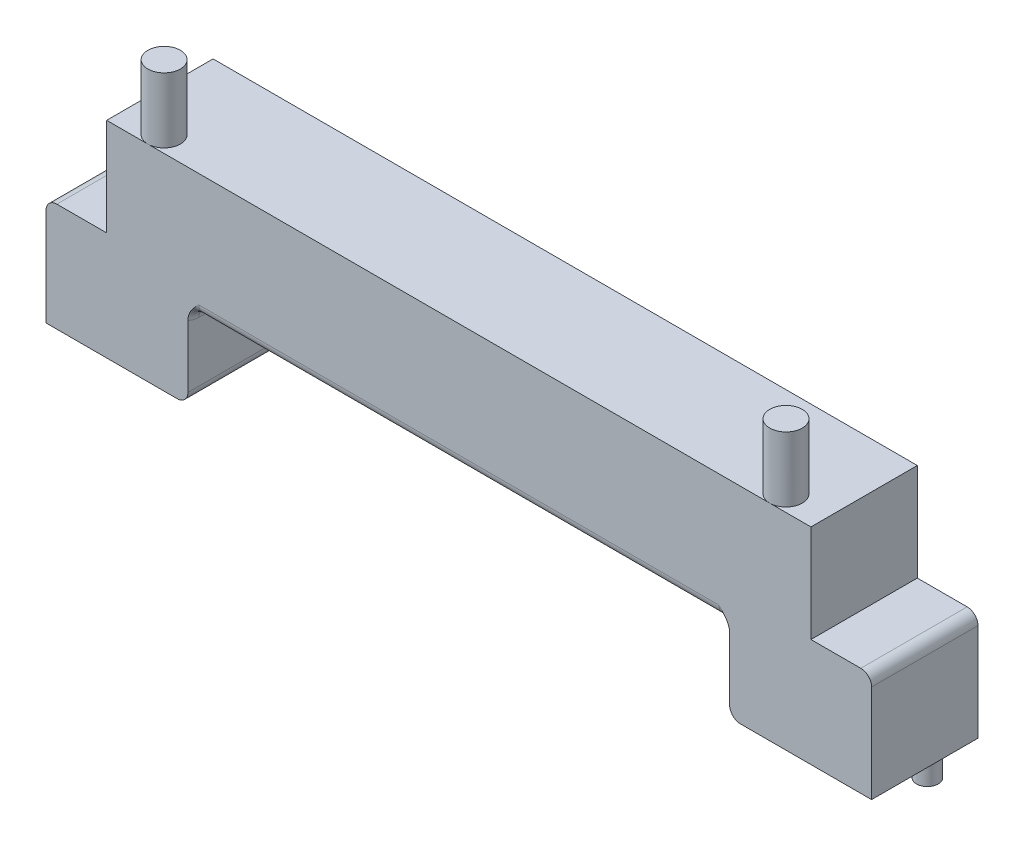
from build123d import *

# Parameters (mm, degrees)
BOSS_EXTRUDE1_DEPTH = 9.82
SKETCH3_R           = 1.5
BOSS_EXTRUDE2_DEPTH = 6
SKETCH5_R           = 1
BOSS_EXTRUDE3_DEPTH = 4
FILLET1_R           = 1
FILLET3_R           = 1


with BuildPart() as part:
    # Sketch2 → Boss-Extrude1 (new body)
    with BuildSketch(Plane.XY):
        Polygon((0, 10), (5.6, 10), (5.6, 19), (70.6, 19), (70.6, 10), (76.2, 10), (76.2, 0), (63.1, 0), (63.1, 7.5), (13.1, 7.5), (13.1, 0), (0, 0), align=None)
    extrude(amount=-BOSS_EXTRUDE1_DEPTH)

    # Sketch3 → Boss-Extrude2 (add)
    with BuildSketch(Plane(origin=(0, 19, 0), x_dir=(1, 0, 0), z_dir=(0, 1, 0))):
        with Locations(Location((9.4, 1.5, 0), (0, 0, 270))):
            Circle(SKETCH3_R)
        with Locations(Location((66.8, 1.5, 0), (0, 0, 90))):
            Circle(SKETCH3_R)
    extrude(amount=BOSS_EXTRUDE2_DEPTH)

    # Sketch5 → Boss-Extrude3 (add)
    with BuildSketch(Plane.XZ):
        with Locations(Location((73.025, -8.32, 0), (0, 0, 270))):
            Circle(SKETCH5_R)
        with Locations(Location((3.175, -8.32, 0), (0, 0, 90))):
            Circle(SKETCH5_R)
    extrude(amount=BOSS_EXTRUDE3_DEPTH)

    # Fillet1
    fillet1_edges = [part.edges().sort_by_distance(p)[0] for p in [
        (38.1, 7.5, 0),
    ]]
    fillet(fillet1_edges, radius=FILLET1_R)

    # Fillet3
    # the kernel refuses this fillet: 1 mm, written as the material it adds along each edge
    with BuildSketch(Plane(origin=(63.1, 7.5, -1), x_dir=(-1, 0, 0), z_dir=(0, 0, -1))) as fillet3_piece_1:
        with BuildLine():
            CenterArc((FILLET3_R, -FILLET3_R), FILLET3_R, 90, 90)
            Line((0, -FILLET3_R), (0, 0))
            Line((0, 0), (FILLET3_R, 0))
        make_face()
    extrude(amount=8.82)
    with BuildSketch(Plane(origin=(13.1, 7.5, -1), x_dir=(1, 0, 0), z_dir=(0, 0, -1))) as fillet3_piece_2:
        with BuildLine():
            CenterArc((FILLET3_R, FILLET3_R), FILLET3_R, 180, 90)
            Line((0, FILLET3_R), (0, 0))
            Line((0, 0), (FILLET3_R, 0))
        make_face()
    extrude(amount=8.82)
    with BuildSketch(Plane(origin=(63.1, 8.5, -1), x_dir=(0, 0.5976672776328268, -0.8017442392976488), z_dir=(0, -0.8017442392976488, -0.5976672776328268))) as fillet3_piece_3_section:
        with BuildLine():
            CenterArc((1 + FILLET3_R, -FILLET3_R), FILLET3_R, 90, 90)
            Line((1 + FILLET3_R, 0), (1, 0))
            Line((1, 0), (1, -FILLET3_R))
        make_face()
    fillet3_piece_3 = revolve(axis=Axis((63.1, 8.5, -1), (1, 0, 0)), revolution_arc=233.296989237, mode=Mode.PRIVATE)
    fillet3_piece_3 = split(fillet3_piece_3, bisect_by=Plane(origin=(62.788371694, 7.750061053, 0), z_dir=(0, 0, -1)), keep=Keep.TOP, mode=Mode.PRIVATE)
    add(fillet3_piece_3)
    with BuildSketch(Plane(origin=(13.1, 8.5, -1), x_dir=(0, 0.5976672776328246, -0.8017442392976504), z_dir=(0, -0.8017442392976504, -0.5976672776328246))) as fillet3_piece_4_section:
        with BuildLine():
            CenterArc((1 + FILLET3_R, FILLET3_R), FILLET3_R, 180, 90)
            Line((1, FILLET3_R), (1, 0))
            Line((1, 0), (1 + FILLET3_R, 0))
        make_face()
    fillet3_piece_4 = revolve(axis=Axis((13.1, 8.5, -1), (1, 0, 0)), revolution_arc=233.296989237, mode=Mode.PRIVATE)
    fillet3_piece_4 = split(fillet3_piece_4, bisect_by=Plane(origin=(13.411628296, 7.750061029, 0), z_dir=(0, 0, -1)), keep=Keep.TOP, mode=Mode.PRIVATE)
    add(fillet3_piece_4)
    # the kernel refuses this fillet: 1 mm, written as the material it takes off along each edge
    with BuildSketch(Plane(origin=(63.1, 0, 2.5), x_dir=(0, 1, 0), z_dir=(0, 0, -1)), Plane(origin=(13.1, 0, 2.5), x_dir=(-1, 0, 0), z_dir=(0, 0, -1)), Plane(origin=(0, 10, 2.5), x_dir=(1, 0, 0), z_dir=(0, 0, -1)), Plane(origin=(76.2, 10, 2.5), x_dir=(0, -1, 0), z_dir=(0, 0, -1))) as fillet3_2_piece_1:
        with BuildLine():
            CenterArc((FILLET3_R, FILLET3_R), FILLET3_R, 180, 90)
            Line((0, FILLET3_R), (0, 0))
            Line((0, 0), (FILLET3_R, 0))
        make_face()
    extrude(amount=14.82, mode=Mode.SUBTRACT)


solid = part.part
